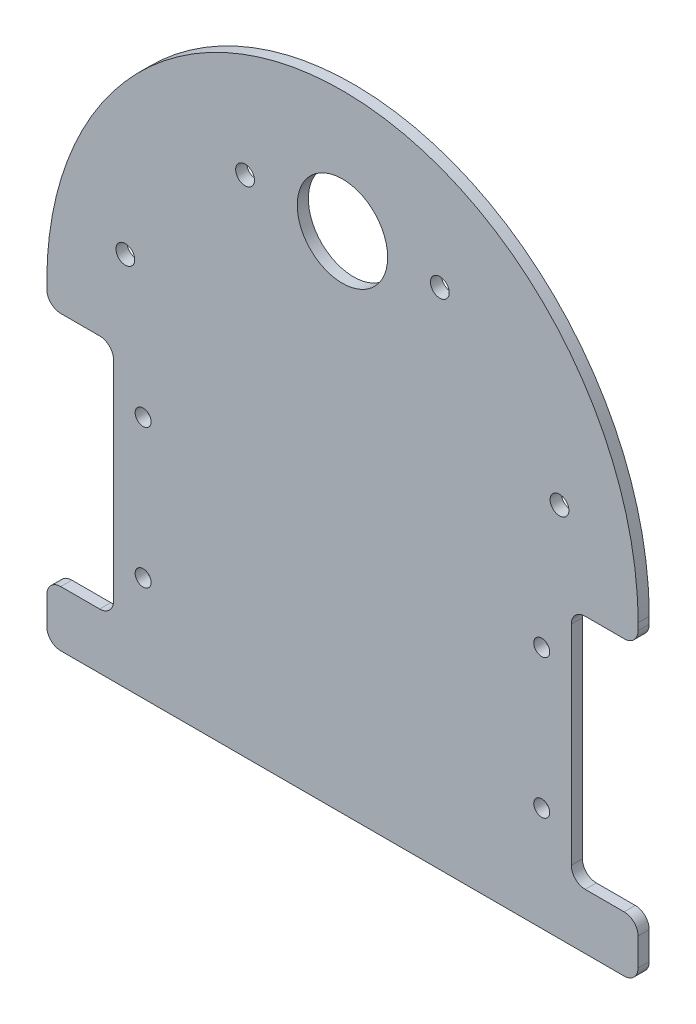
from build123d import *

# Parameters (mm, degrees)
SKETCH1_W           = 85
SKETCH1_H           = 90
BOSS_EXTRUDE1_DEPTH = 1.6
CUT_EXTRUDE1_DEPTH  = 62.917768048
SKETCH3_W           = 9.6
SKETCH3_H           = 34
CUT_EXTRUDE2_DEPTH  = 62.917768192
SKETCH4_R           = 6.5
CUT_EXTRUDE3_DEPTH  = 62.917768192
SKETCH5_R           = 1.15
CUT_EXTRUDE4_DEPTH  = 62.917768192
SKETCH6_R           = 1.35
CUT_EXTRUDE5_DEPTH  = 62.917768192
FILLET1_R           = 2
SKETCH7_R           = 1.35
CUT_EXTRUDE6_DEPTH  = 10


with BuildPart() as part:
    # Sketch1 → Boss-Extrude1 (new body)
    with BuildSketch(Plane.XY):
        Rectangle(SKETCH1_W, SKETCH1_H)
    extrude(amount=BOSS_EXTRUDE1_DEPTH)

    # Sketch2 → Cut-Extrude1 (cut, through all)
    with BuildSketch(Plane.XY.offset(1.6)):
        with BuildLine():
            Line((-42.5, 0), (-70, 0))
            Line((-70, 0), (-70, 70))
            Line((-70, 70), (70, 70))
            Line((70, 70), (70, 0))
            Line((70, 0), (42.5, 0))
            add(Edge.make_bspline(
                [(42.5, 0), (42.5, 45), (0, 45), (-42.5, 45), (-42.5, 0)],
                knots=[1.570796327, 1.570796327, 1.570796327, 3.141592654, 3.141592654, 4.71238898, 4.71238898, 4.71238898], degree=2, weights=[1, 0.707106781, 1, 0.707106781, 1]))
        make_face()
    extrude(amount=-CUT_EXTRUDE1_DEPTH, mode=Mode.SUBTRACT)

    # Sketch3 → Cut-Extrude2 (cut, through all)
    with BuildSketch(Plane.XY.offset(1.6)):
        with Locations((-37.7, -20)):
            Rectangle(SKETCH3_W, SKETCH3_H)
        with Locations((37.7, -20)):
            Rectangle(SKETCH3_W, SKETCH3_H)
    extrude(amount=-CUT_EXTRUDE2_DEPTH, mode=Mode.SUBTRACT)

    # Sketch4 → Cut-Extrude3 (cut, through all)
    with BuildSketch(Plane.XY.offset(1.6)):
        with Locations((0, 27.5)):
            Circle(SKETCH4_R)
    extrude(amount=-CUT_EXTRUDE3_DEPTH, mode=Mode.SUBTRACT)

    # Sketch5 → Cut-Extrude4 (cut, through all)
    with BuildSketch(Plane.XY.offset(1.6)):
        with Locations((-28.65, -10)):
            Circle(SKETCH5_R)
        with Locations((-28.65, -30)):
            Circle(SKETCH5_R)
        with Locations((28.65, -30)):
            Circle(SKETCH5_R)
        with Locations((28.65, -10)):
            Circle(SKETCH5_R)
    extrude(amount=-CUT_EXTRUDE4_DEPTH, mode=Mode.SUBTRACT)

    # Sketch6 → Cut-Extrude5 (cut, through all)
    with BuildSketch(Plane.XY.offset(1.6)):
        with Locations((-14, 27.5)):
            Circle(SKETCH6_R)
        with Locations((14, 27.5)):
            Circle(SKETCH6_R)
    extrude(amount=-CUT_EXTRUDE5_DEPTH, mode=Mode.SUBTRACT)

    # Fillet1
    fillet1_edges = [part.edges().sort_by_distance(p)[0] for p in [
        (42.5, -37, 0.8),
        (32.9, -37, 0.8),
        (32.9, -3, 0.8),
        (42.5, -3, 0.8),
        (-32.9, -37, 0.8),
        (-32.9, -3, 0.8),
        (-42.5, -37, 0.8),
        (-42.5, -3, 0.8),
        (42.5, -45, 0.8),
        (-42.5, -45, 0.8),
    ]]
    fillet(fillet1_edges, radius=FILLET1_R)

    # Sketch7 → Cut-Extrude6 (cut)
    with BuildSketch(Plane.XY.offset(1.6)):
        with Locations((-31.2085, 9)):
            Circle(SKETCH7_R)
        with Locations((31.2085, 9)):
            Circle(SKETCH7_R)
    extrude(amount=-CUT_EXTRUDE6_DEPTH, mode=Mode.SUBTRACT)


solid = part.part
